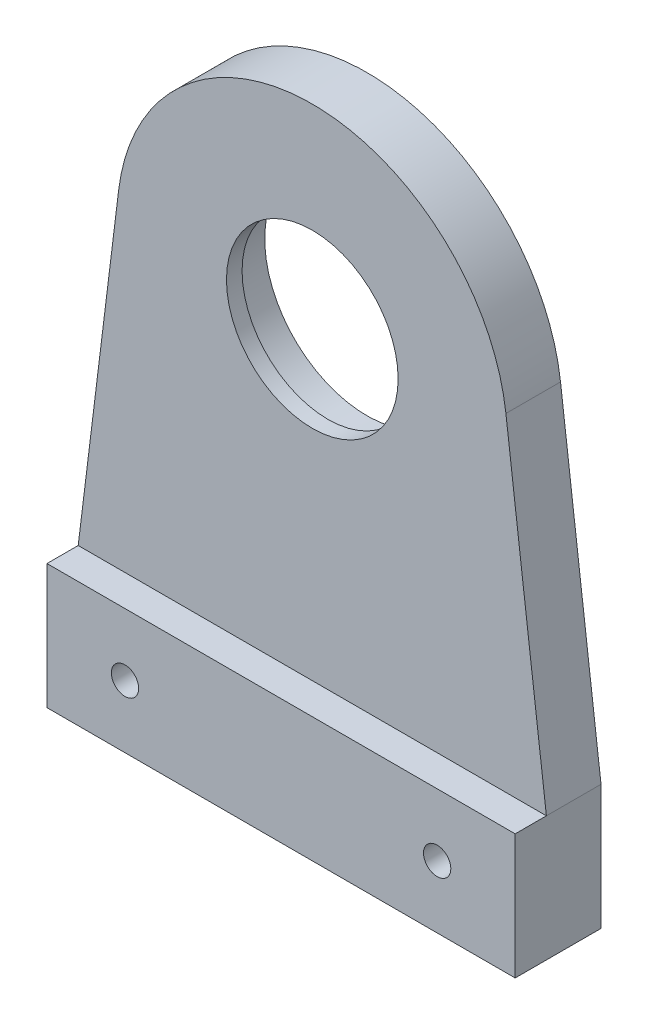
from build123d import *

# Parameters (mm, degrees)
SKETCH1_R           = 13.1
SKETCH1_R_2         = 1.75
BOSS_EXTRUDE1_DEPTH = 7
BOSS_EXTRUDE2_START = -2
SKETCH2_R           = 13.1
SKETCH2_R_2         = 11
BOSS_EXTRUDE2_DEPTH = 2
SKETCH3_W           = 60
SKETCH3_H           = 16
SKETCH3_R           = 1.75
BOSS_EXTRUDE3_DEPTH = 4
SKETCH4_R           = 3.75
CUT_EXTRUDE1_DEPTH  = 4


with BuildPart() as part:
    # Sketch1 → Boss-Extrude1 (new body)
    with BuildSketch(Plane.XY):
        with BuildLine():
            Line((-30, -55), (30, -55))
            Line((30, -55), (30, -39))
            Line((30, -39), (24.811961667, 3.060483334))
            ThreePointArc((24.811961667, 3.060483334), (0, 25), (-24.811961667, 3.060483334))
            Line((-24.811961667, 3.060483334), (-30, -39))
            Line((-30, -39), (-30, -55))
        make_face()
        Circle(SKETCH1_R, mode=Mode.SUBTRACT)
        with Locations((-20, -47)):
            Circle(SKETCH1_R_2, mode=Mode.SUBTRACT)
        with Locations((20, -47)):
            Circle(SKETCH1_R_2, mode=Mode.SUBTRACT)
    extrude(amount=BOSS_EXTRUDE1_DEPTH)

    # Sketch2 → Boss-Extrude2 (add)
    with BuildSketch(Plane.XY.offset(7).offset(BOSS_EXTRUDE2_START)):
        Circle(SKETCH2_R)
        Circle(SKETCH2_R_2, mode=Mode.SUBTRACT)
    extrude(amount=BOSS_EXTRUDE2_DEPTH)

    # Sketch3 → Boss-Extrude3 (add)
    with BuildSketch(Plane.XY.offset(7)):
        with Locations((0, -47)):
            Rectangle(SKETCH3_W, SKETCH3_H)
        with Locations((20, -47)):
            Circle(SKETCH3_R, mode=Mode.SUBTRACT)
        with Locations((-20, -47)):
            Circle(SKETCH3_R, mode=Mode.SUBTRACT)
    extrude(amount=BOSS_EXTRUDE3_DEPTH)

    # Sketch4 → Cut-Extrude1 (cut)
    with BuildSketch(Plane(origin=(0, 0, 0), x_dir=(-1, 0, 0), z_dir=(0, 0, -1))):
        with Locations((-20, -47)):
            Circle(SKETCH4_R)
        with Locations((20, -47)):
            Circle(SKETCH4_R)
    extrude(amount=-CUT_EXTRUDE1_DEPTH, mode=Mode.SUBTRACT)


solid = part.part
